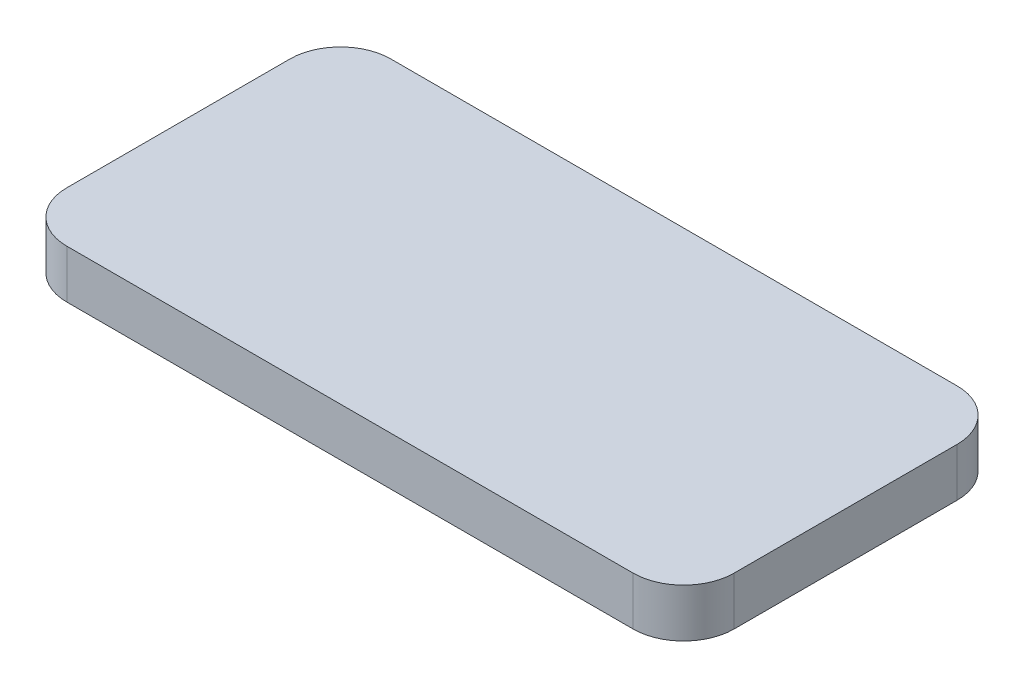
from build123d import *

# Parameters (mm, degrees)
BOSS_EXTRUDE1_DEPTH = 2.54


with BuildPart() as part:
    # Sketch1 → Boss-Extrude1 (new body)
    with BuildSketch(Plane(origin=(0, 0, 0), x_dir=(1, 0, 0), z_dir=(0, 1, 0))):
        with BuildLine():
            Line((-14.848974803, -8.50011), (14.848974803, -8.50011))
            ThreePointArc((14.848974803, -8.50011), (16.723956961, -7.723466961), (17.5006, -5.848484803))
            Line((17.5006, -5.848484803), (17.5006, 5.848484803))
            ThreePointArc((17.5006, 5.848484803), (16.723956961, 7.723466961), (14.848974803, 8.50011))
            Line((14.848974803, 8.50011), (-14.848974803, 8.50011))
            ThreePointArc((-14.848974803, 8.50011), (-16.723956961, 7.723466961), (-17.5006, 5.848484803))
            Line((-17.5006, 5.848484803), (-17.5006, -5.848484803))
            ThreePointArc((-17.5006, -5.848484803), (-16.723956961, -7.723466961), (-14.848974803, -8.50011))
        make_face()
    extrude(amount=BOSS_EXTRUDE1_DEPTH)


solid = part.part
